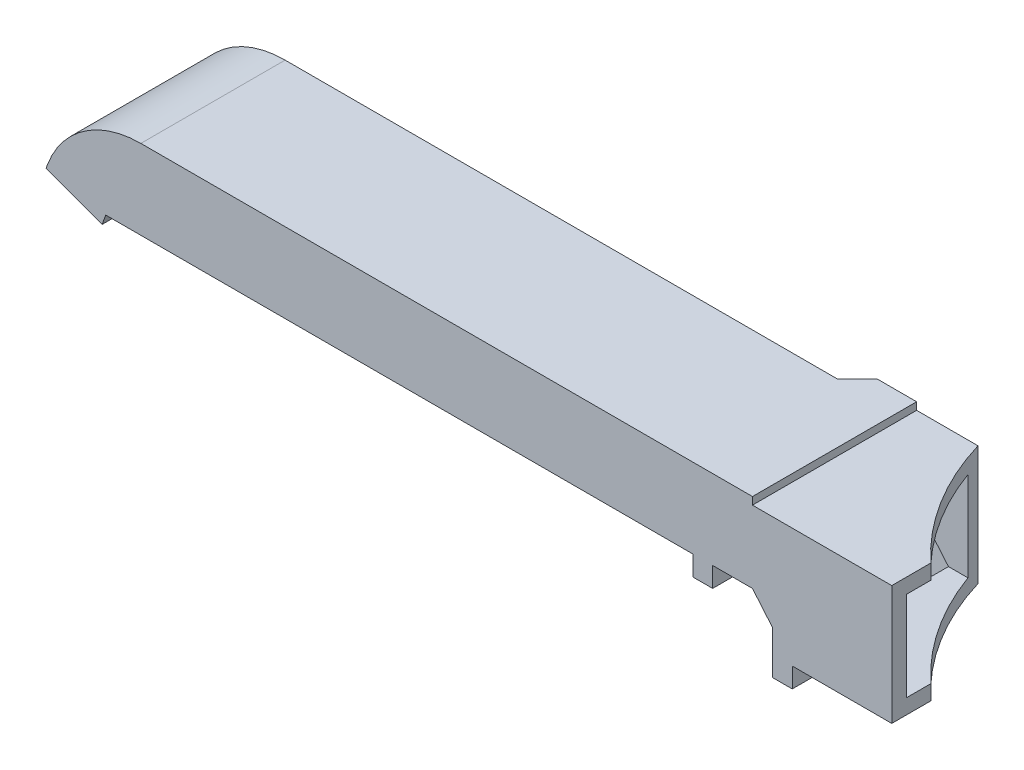
from build123d import *

# Parameters (mm, degrees)
RESSALTO_EXTRUS_O1_DEPTH = 16.5
CORTE_EXTRUS_O1_START    = -14.5
ESBO_O2_W                = 84.883298415
ESBO_O2_H                = 23.037156827
CORTE_EXTRUS_O1_DEPTH    = 14.5
CHANFRO1_SIZE            = 3
CASCA1_T                 = -1.5
CORTE_EXTRUS_O2_DEPTH    = 88.520354775
ESBO_O5_W                = 2
ESBO_O5_H                = 2
RESSALTO_EXTRUS_O2_DEPTH = 10


with BuildPart() as part:
    # Esboço1 → Ressalto-extrusão1 (new body)
    with BuildSketch(Plane.XY):
        with BuildLine():
            Line((9.53089658, 0), (71, 0))
            Line((71, 0), (71, -0.75))
            Line((71, -0.75), (85, -0.75))
            Line((85, -0.75), (85, -12.75))
            Line((85, -12.75), (75, -12.75))
            Line((75, -12.75), (71, -8))
            Line((71, -8), (6.002125959, -8))
            Line((6.002125959, -8), (5.638155725, -9))
            Line((5.638155725, -9), (0, -6.94787914))
            Line((0, -6.94787914), (0.133970372, -6.579798567))
            ThreePointArc((0.133970372, -6.579798567), (3.795132217, -1.808479557), (9.53089658, 0))
        make_face()
    extrude(amount=RESSALTO_EXTRUS_O1_DEPTH)

    # Esboço2 → Corte-extrusão1 (cut)
    with BuildSketch(Plane.XY.offset(16.5).offset(CORTE_EXTRUS_O1_START)):
        with Locations((25.558350793, -2.469824016)):
            Rectangle(ESBO_O2_W, ESBO_O2_H)
    extrude(amount=-CORTE_EXTRUS_O1_DEPTH, mode=Mode.SUBTRACT)

    # Chanfro1
    # the kernel refuses this chamfer: 3 mm, written as the material it adds along each edge
    with BuildSketch(Plane(origin=(68, 0, 2), x_dir=(-0.9996219169112968, 0, 0.027495876610586334), z_dir=(0, -1, 0))) as chanfro1_piece_1_section:
        Polygon((CHANFRO1_SIZE * 0.999621916911, CHANFRO1_SIZE * 0.0274958766106), (-CHANFRO1_SIZE * 0.0274958766106, CHANFRO1_SIZE * 0.999621916911), (0, 0), align=None)
    chanfro1_piece_1 = extrude(amount=8, mode=Mode.PRIVATE)
    chanfro1_piece_1 = split(chanfro1_piece_1, bisect_by=Plane(origin=(66.907908995, -4, 0), z_dir=(0, 0, 1)), keep=Keep.TOP, mode=Mode.PRIVATE)
    add(chanfro1_piece_1)

    # Casca1
    casca1_openings = [part.faces().sort_by_distance(p)[0] for p in [
        (85, -6.75, 8.25),
        (2.819077862, -7.97393957, 9.25),
    ]]
    offset(amount=CASCA1_T, openings=casca1_openings, kind=Kind.INTERSECTION)

    # Esboço4 → Corte-extrusão2 (cut, through all)
    with BuildSketch(Plane.XZ.offset(12.75)):
        with BuildLine():
            Line((77.16718427, 0), (85, 0))
            Line((85, 0), (85, 12.566963801))
            ThreePointArc((85, 12.566963801), (80.237763274, 6.810675399), (77.16718427, 0))
        make_face()
    extrude(amount=-CORTE_EXTRUS_O2_DEPTH, mode=Mode.SUBTRACT)

    # Esboço5 → Ressalto-extrusão2 (add)
    with BuildSketch(Plane.XY.offset(16.5)):
        with Locations((66, -9)):
            Rectangle(ESBO_O5_W, ESBO_O5_H)
        Polygon((75, -14.75), (73, -14.75), (73, -10.375), (75, -12.75), align=None)
    extrude(amount=-RESSALTO_EXTRUS_O2_DEPTH)


solid = part.part
